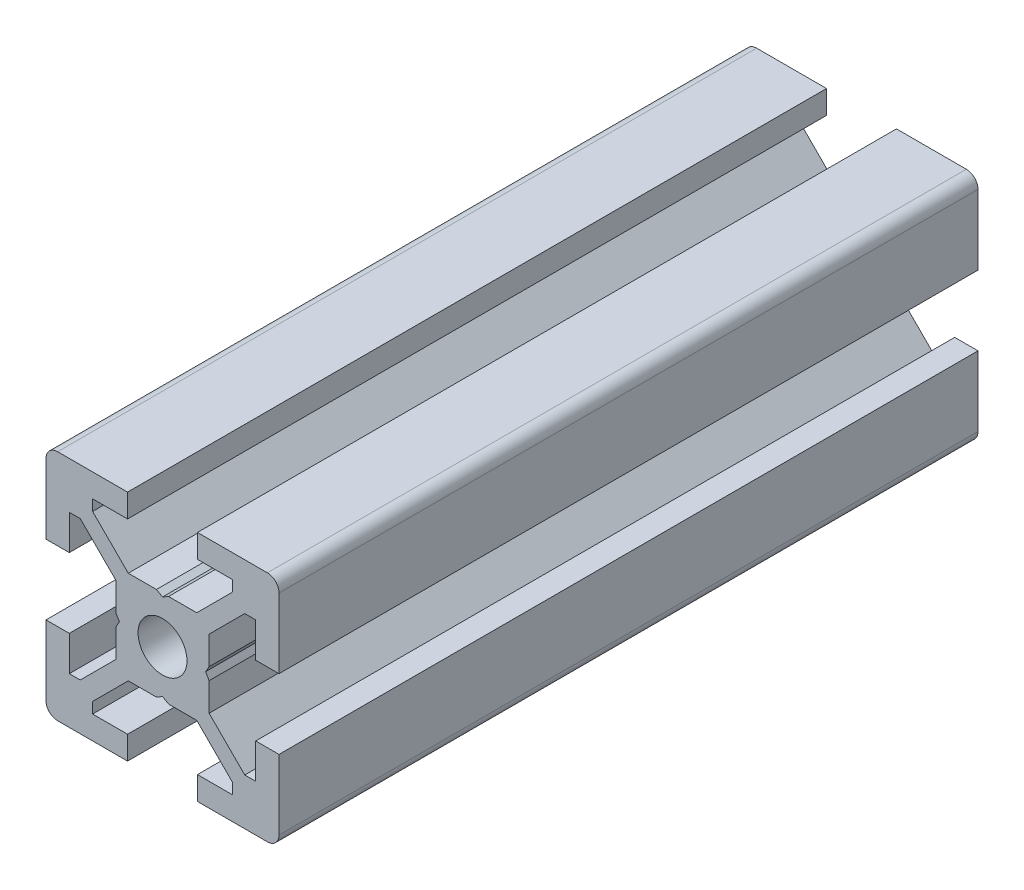
from build123d import *

# Parameters (mm, degrees)
BOSS_EXTRUDE1_DEPTH = 60
SKETCH2_W           = 60
SKETCH2_H           = 2.1


with BuildPart() as part:
    # Sketch1 → Boss-Extrude1 (new body)
    with BuildSketch(Plane.XY):
        with BuildLine():
            Line((-10, -3), (-10, -9))
            ThreePointArc((-10, -9), (-9.707106781, -9.707106781), (-9, -10))
            Line((-9, -10), (-3, -10))
            Line((-3, -10), (-3, -8))
            Line((-3, -8), (-6, -8))
            Line((-6, -8), (-6, -7.060660172))
            Line((-6, -7.060660172), (-2.939339828, -4))
            Line((-2.939339828, -4), (-0.519615242, -4))
            Line((-0.519615242, -4), (0, -3.7))
            Line((0, -3.7), (0.519615242, -4))
            Line((0.519615242, -4), (2.939339828, -4))
            Line((2.939339828, -4), (6, -7.060660172))
            Line((6, -7.060660172), (6, -8))
            Line((6, -8), (3, -8))
            Line((3, -8), (3, -10))
            Line((3, -10), (9, -10))
            ThreePointArc((9, -10), (9.707106781, -9.707106781), (10, -9))
            Line((10, -9), (10, -3))
            Line((10, -3), (8, -3))
            Line((8, -3), (8, -6))
            Line((8, -6), (7.060660172, -6))
            Line((7.060660172, -6), (4, -2.939339828))
            Line((4, -2.939339828), (4, -0.519615242))
            Line((4, -0.519615242), (3.7, 0))
            Line((3.7, 0), (4, 0.519615242))
            Line((4, 0.519615242), (4, 2.939339828))
            Line((4, 2.939339828), (7.060660172, 6))
            Line((7.060660172, 6), (8, 6))
            Line((8, 6), (8, 3))
            Line((8, 3), (10, 3))
            Line((10, 3), (10, 9))
            ThreePointArc((10, 9), (9.707106781, 9.707106781), (9, 10))
            Line((9, 10), (3, 10))
            Line((3, 10), (3, 8))
            Line((3, 8), (6, 8))
            Line((6, 8), (6, 7.060660172))
            Line((6, 7.060660172), (2.939339828, 4))
            Line((2.939339828, 4), (0.519615242, 4))
            Line((0.519615242, 4), (0, 3.7))
            Line((0, 3.7), (-0.519615242, 4))
            Line((-0.519615242, 4), (-2.939339828, 4))
            Line((-2.939339828, 4), (-6, 7.060660172))
            Line((-6, 7.060660172), (-6, 8))
            Line((-6, 8), (-3, 8))
            Line((-3, 8), (-3, 10))
            Line((-3, 10), (-9, 10))
            ThreePointArc((-9, 10), (-9.707106781, 9.707106781), (-10, 9))
            Line((-10, 9), (-10, 3))
            Line((-10, 3), (-8, 3))
            Line((-8, 3), (-8, 6))
            Line((-8, 6), (-7.060660172, 6))
            Line((-7.060660172, 6), (-4, 2.939339828))
            Line((-4, 2.939339828), (-4, 0.519615242))
            Line((-4, 0.519615242), (-3.7, 0))
            Line((-3.7, 0), (-4, -0.519615242))
            Line((-4, -0.519615242), (-4, -2.939339828))
            Line((-4, -2.939339828), (-7.060660172, -6))
            Line((-7.060660172, -6), (-8, -6))
            Line((-8, -6), (-8, -3))
            Line((-8, -3), (-10, -3))
        make_face()
    extrude(amount=-BOSS_EXTRUDE1_DEPTH)

    # Sketch2 → Cut-Revolve1 (revolve, cut)
    with BuildSketch(Plane(origin=(0, 0, 0), x_dir=(0, 0, -1), z_dir=(1, 0, 0))):
        with Locations((30, 1.05)):
            Rectangle(SKETCH2_W, SKETCH2_H)
    revolve(axis=Axis((0, 0, -60), (0, 0, 1)), mode=Mode.SUBTRACT)


solid = part.part
